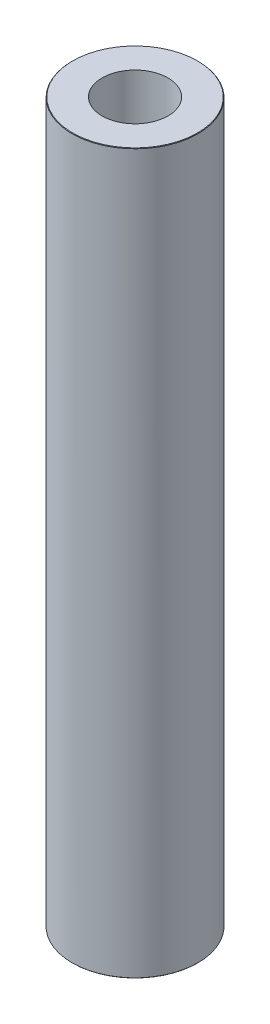
from build123d import *

# Parameters (mm, degrees)
SKETCH1_R           = 52.5
BOSS_EXTRUDE1_DEPTH = 600
SKETCH2_R           = 27.515911337
CUT_EXTRUDE1_DEPTH  = 605.576297914
CHAMFER1_SIZE       = 0.389754464


with BuildPart() as part:
    # Sketch1 → Boss-Extrude1 (new body)
    with BuildSketch(Plane(origin=(0, 0, 0), x_dir=(1, 0, 0), z_dir=(0, 1, 0))):
        Circle(SKETCH1_R)
    extrude(amount=BOSS_EXTRUDE1_DEPTH)

    # Sketch2 → Cut-Extrude1 (cut, through all)
    with BuildSketch(Plane(origin=(0, 0, 0), x_dir=(1, 0, 0), z_dir=(0, 1, 0))):
        Circle(SKETCH2_R)
    extrude(amount=CUT_EXTRUDE1_DEPTH, mode=Mode.SUBTRACT)

    # Chamfer1
    chamfer1_edges = [part.edges().sort_by_distance(p)[0] for p in [
        (-52.5, 600, 0),
        (-52.5, 0, 0),
    ]]
    chamfer(chamfer1_edges, length=CHAMFER1_SIZE)


solid = part.part
